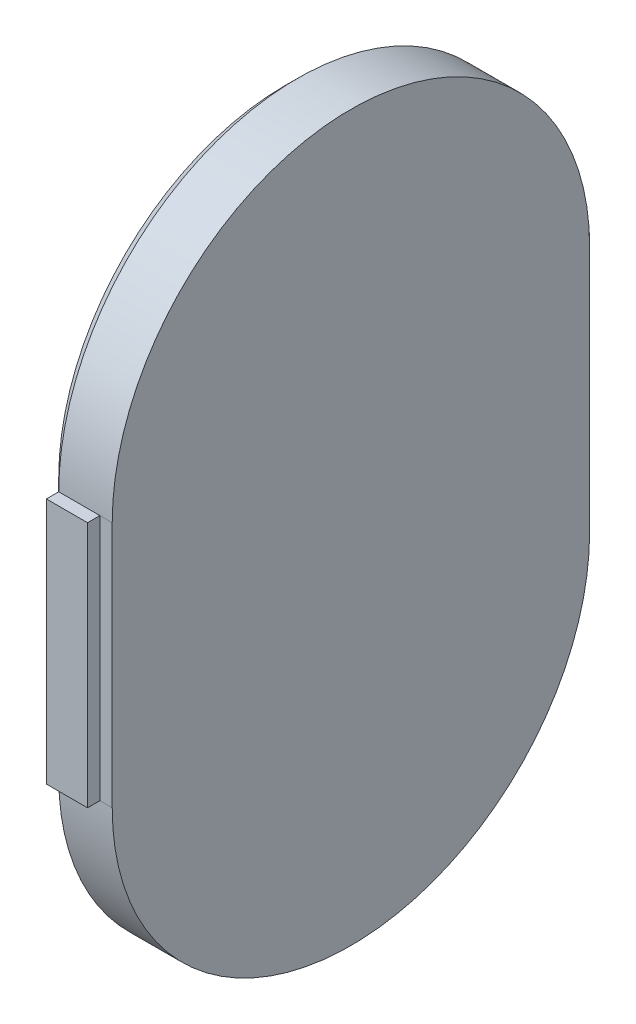
from build123d import *

# Parameters (mm, degrees)
BOSS_EXTRUDE1_START = -63
BOSS_EXTRUDE1_DEPTH = 1.6
CHAMFER1_SIZE       = 0.3
BOSS_EXTRUDE2_START = 61.3
SKETCH2_W           = 1
SKETCH2_H           = 6
BOSS_EXTRUDE2_DEPTH = 0.31
BOSS_EXTRUDE3_START = 73.19
SKETCH3_W           = 1
SKETCH3_H           = 6
BOSS_EXTRUDE3_DEPTH = 0.31
BOSS_EXTRUDE4_START = 65.9
SKETCH4_W           = 0.7
SKETCH4_H           = 1.3
BOSS_EXTRUDE4_DEPTH = 3


with BuildPart() as part:
    # Sketch1 → Boss-Extrude1 (new body)
    with BuildSketch(Plane(origin=(0, 0, 0), x_dir=(0, 0, -1), z_dir=(1, 0, 0)).offset(BOSS_EXTRUDE1_START)):
        with BuildLine():
            Line((-73.2, 110), (-73.2, 116))
            ThreePointArc((-73.2, 116), (-71.501219331, 120.101219331), (-67.4, 121.8))
            ThreePointArc((-67.4, 121.8), (-63.298780669, 120.101219331), (-61.6, 116))
            Line((-61.6, 116), (-61.6, 110))
            ThreePointArc((-61.6, 110), (-63.298780669, 105.898780669), (-67.4, 104.2))
            ThreePointArc((-67.4, 104.2), (-71.501219331, 105.898780669), (-73.2, 110))
        make_face()
    extrude(amount=BOSS_EXTRUDE1_DEPTH)

    # Chamfer1
    chamfer1_edges = [part.edges().sort_by_distance(p)[0] for p in [
        (-63, 104.2, 67.4),
        (-63, 113, 61.6),
        (-63, 113, 73.2),
        (-63, 121.8, 67.4),
    ]]
    chamfer(chamfer1_edges, length=CHAMFER1_SIZE)

    # Sketch2 → Boss-Extrude2 (add)
    with BuildSketch(Plane.XY.offset(BOSS_EXTRUDE2_START)):
        with Locations((-62.2, 113)):
            Rectangle(SKETCH2_W, SKETCH2_H)
    extrude(amount=BOSS_EXTRUDE2_DEPTH)

    # Sketch3 → Boss-Extrude3 (add)
    with BuildSketch(Plane.XY.offset(BOSS_EXTRUDE3_START)):
        with Locations((-62.2, 113)):
            Rectangle(SKETCH3_W, SKETCH3_H)
    extrude(amount=BOSS_EXTRUDE3_DEPTH)


with BuildPart() as body_2:
    # Sketch4 → Boss-Extrude4 (new body)
    with BuildSketch(Plane.XY.offset(BOSS_EXTRUDE4_START)):
        with Locations((-62.75, 104.75)):
            Rectangle(SKETCH4_W, SKETCH4_H)
    extrude(amount=BOSS_EXTRUDE4_DEPTH)


with BuildPart() as part_1:
    add(part.part)

    # Combine1: cut body 2
    add(body_2.part, mode=Mode.SUBTRACT)


solid = part_1.part
